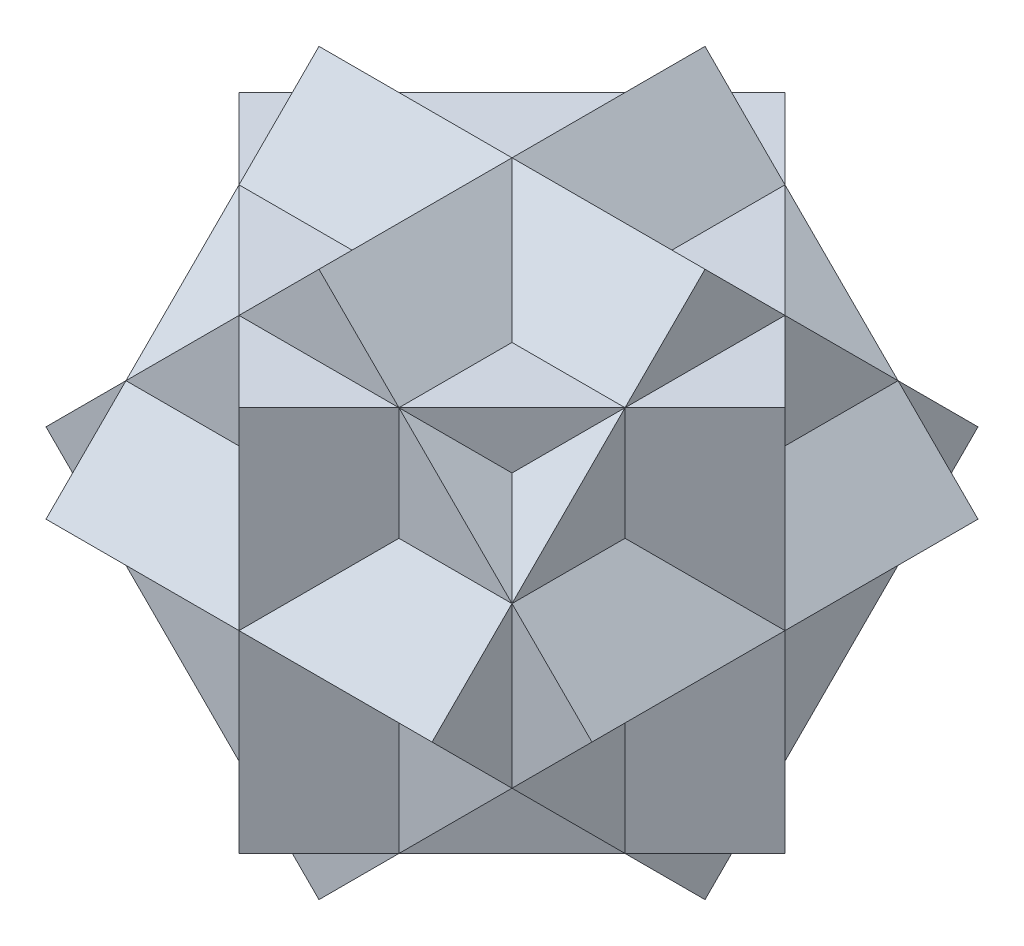
from build123d import *

# Parameters (mm, degrees)
BOSS_EXTRUDE1_DEPTH = 109.704877872
BOSS_EXTRUDE2_DEPTH = 109.704877872
BOSS_EXTRUDE3_DEPTH = 109.704877872


with BuildPart() as part:
    # Sketch3 → Boss-Extrude1 (new, symmetric)
    with BuildSketch(Plane.XY):
        Polygon((-155.146126145, 0), (0, 155.146126145), (155.146126145, 0), (0, -155.146126145), align=None)
    extrude(amount=BOSS_EXTRUDE1_DEPTH, both=True)

    # Sketch4 → Boss-Extrude2 (add, symmetric)
    with BuildSketch(Plane(origin=(0, 0, 0), x_dir=(1, 0, 0), z_dir=(0, 1, 0))):
        Polygon((-155.146126145, 0), (0, 155.146126145), (155.146126145, 0), (0, -155.146126145), align=None)
    extrude(amount=BOSS_EXTRUDE2_DEPTH, both=True)

    # Sketch5 → Boss-Extrude3 (add, symmetric)
    with BuildSketch(Plane(origin=(0, 0, 0), x_dir=(0, 0, -1), z_dir=(1, 0, 0))):
        Polygon((-155.146126145, 0), (0, 155.146126145), (155.146126145, 0), (0, -155.146126145), align=None)
    extrude(amount=BOSS_EXTRUDE3_DEPTH, both=True)


solid = part.part
